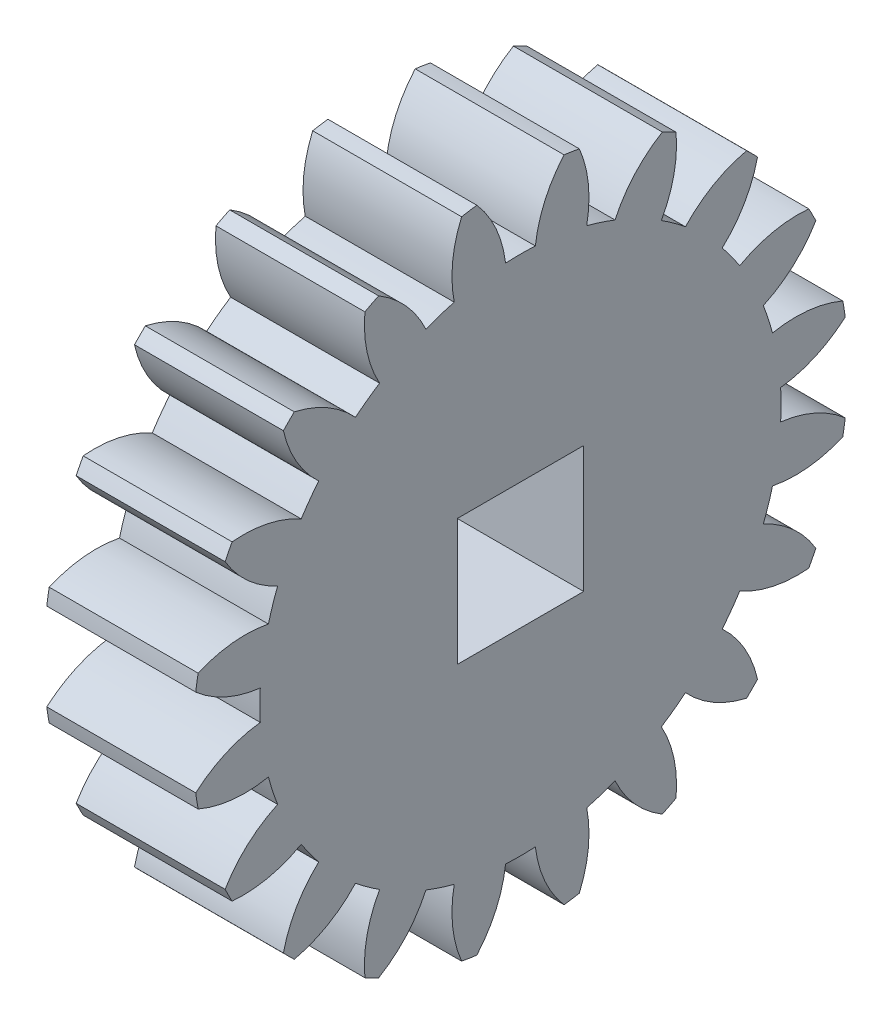
from build123d import *

# Parameters (mm, degrees)
BASPROSKE_W        = 5
BASPROSKE_H        = 11
TOOTHCUT_DEPTH     = 17.340134638
TEETHCUTS_COUNT    = 20
TEETHCUTS_ANGLE    = 342
BORSKE_R           = 0.4
BORE_DEPTH         = 50.0000508
SKETCH1_W          = 4.242640688
SKETCH1_H          = 4.242640688
CUT_EXTRUDE1_DEPTH = 17.208263488


with BuildPart() as part:
    # BasProSke → Base-Revolve (revolve)
    with BuildSketch(Plane(origin=(0, 0, 0), x_dir=(1, 0, 0), z_dir=(0, 1, 0))):
        with Locations((2.5, 5.5)):
            Rectangle(BASPROSKE_W, BASPROSKE_H)
    revolve(axis=Axis((-10, 0, 0), (1, 0, 0)))

    # TooCutSke → ToothCut (cut, through all)
    with BuildSketch(Plane(origin=(0, 0, 0), x_dir=(0, 0, -1), z_dir=(1, 0, 0))):
        with BuildLine():
            ThreePointArc((0.499924007, 8.734705318), (0, 8.749), (-0.499924007, 8.734705318))
            ThreePointArc((-0.499924007, 8.734705318), (-0.824302243, 9.905497836), (-1.485192705, 10.924909509))
            ThreePointArc((-1.485192705, 10.924909509), (0, 11.0254), (1.485192705, 10.924909509))
            ThreePointArc((1.485192705, 10.924909509), (0.824302243, 9.905497836), (0.499924007, 8.734705318))
        make_face()
    toothcut = extrude(amount=TOOTHCUT_DEPTH, mode=Mode.SUBTRACT)

    # TeethCuts: ToothCut ×20 about axis
    teethcuts_axis = Axis((-10, 0, 0), (1, 0, 0))
    for i in range(1, TEETHCUTS_COUNT):
        add(toothcut.rotate(teethcuts_axis, i * TEETHCUTS_ANGLE / (TEETHCUTS_COUNT - 1)), mode=Mode.SUBTRACT)

    # BorSke → Bore (cut, symmetric)
    with BuildSketch(Plane(origin=(0, 0, 0), x_dir=(0, 0, -1), z_dir=(1, 0, 0))):
        Circle(BORSKE_R)
    extrude(amount=BORE_DEPTH, both=True, mode=Mode.SUBTRACT)

    # Sketch1 → Cut-Extrude1 (cut, through all)
    with BuildSketch(Plane(origin=(5, 0, 0), x_dir=(0, 0, -1), z_dir=(1, 0, 0))):
        Rectangle(SKETCH1_W, SKETCH1_H)
    extrude(amount=-CUT_EXTRUDE1_DEPTH, mode=Mode.SUBTRACT)


solid = part.part
